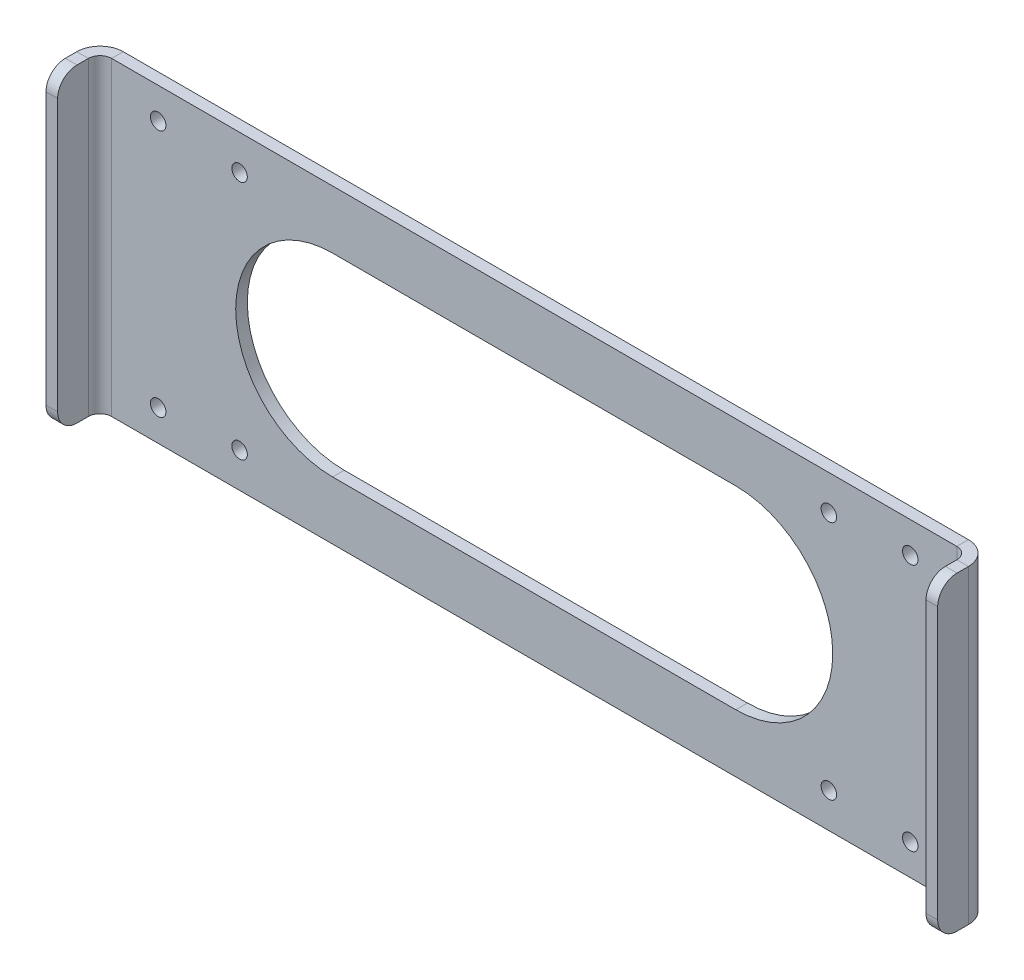
from build123d import *

# Parameters (mm, degrees)
SKETCH_1_W             = 248
SKETCH_1_H             = 80
SM_BASE_FLANGE_1_DEPTH = 3
SKETCH_6_R             = 2
CUT_EXTRUDE_1_DEPTH    = 10
OTHER_START            = -40
OTHER_1_DEPTH          = 80
OTHER_1_2_DEPTH        = 80
CUT_EXTRUDE_2_DEPTH    = 10
FILLET_1_R             = 5


# Read off the part's stored shape, not the designer's step: 绘制的折弯1
# Sheet-metal steps are written as plain solids
with BuildPart() as part:
    # Sketch 1 → 基体-法兰1 (new body)
    with BuildSketch(Plane.XY):
        Rectangle(SKETCH_1_W, SKETCH_1_H)
    extrude(amount=-SM_BASE_FLANGE_1_DEPTH)

    # 草图6 → 切除-拉伸1 (cut)
    with BuildSketch(Plane.XY):
        with Locations((-97, 32)):
            Circle(SKETCH_6_R)
        with Locations((-76, 31)):
            Circle(SKETCH_6_R)
        with Locations((97, 32)):
            Circle(SKETCH_6_R)
        with Locations((76, 31)):
            Circle(SKETCH_6_R)
        with Locations((76, -31)):
            Circle(SKETCH_6_R)
        with Locations((97, -32)):
            Circle(SKETCH_6_R)
        with Locations((-97, -32)):
            Circle(SKETCH_6_R)
        with Locations((-76, -31)):
            Circle(SKETCH_6_R)
    extrude(amount=-CUT_EXTRUDE_1_DEPTH, mode=Mode.SUBTRACT)

    # Other 1 outline → Other 1 (cut)
    with BuildSketch(Plane(origin=(0, 0, 0), x_dir=(1, 0, 0), z_dir=(0, 1, 0)).offset(OTHER_START)):
        with BuildLine():
            Line((124, 3), (109, 3))
            ThreePointArc((109, 3), (112, 2.196152423), (114.196152423, 0))
            Line((114.196152423, 0), (124, 0))
            Line((124, 0), (124, 3))
        make_face()
        with BuildLine():
            ThreePointArc((-114.196152423, 0), (-112, 2.196152423), (-109, 3))
            Line((-109, 3), (-124, 3))
            Line((-124, 3), (-124, 0))
            Line((-124, 0), (-114.196152423, 0))
        make_face()
    extrude(amount=OTHER_1_DEPTH, mode=Mode.SUBTRACT)

    # Other 1 2 outline → Other 1 2 (add)
    with BuildSketch(Plane(origin=(0, 0, 0), x_dir=(1, 0, 0), z_dir=(0, 1, 0)).offset(OTHER_START)):
        with BuildLine():
            ThreePointArc((115, -3), (114.795554958, -1.447085729), (114.196152423, 0))
            Line((114.196152423, 0), (109, 0))
            ThreePointArc((109, 0), (111.121320344, -0.878679656), (112, -3))
            Line((112, -3), (112, -10.931416529))
            Line((112, -10.931416529), (115, -10.931416529))
            Line((115, -10.931416529), (115, -3))
        make_face()
        with BuildLine():
            Line((-109, 0), (-114.196152423, 0))
            ThreePointArc((-114.196152423, 0), (-114.795554958, -1.447085729), (-115, -3))
            Line((-115, -3), (-115, -10.931416529))
            Line((-115, -10.931416529), (-112, -10.931416529))
            Line((-112, -10.931416529), (-112, -3))
            ThreePointArc((-112, -3), (-111.121320344, -0.878679656), (-109, 0))
        make_face()
    extrude(amount=OTHER_1_2_DEPTH)

    # 草图8 → 切除-拉伸2 (cut)
    with BuildSketch(Plane(origin=(0, 0, -3), x_dir=(-1, 0, 0), z_dir=(0, 0, -1))):
        with BuildLine():
            Line((-52, 25), (52, 25))
            ThreePointArc((52, 25), (77, 0), (52, -25))
            Line((52, -25), (-52, -25))
            ThreePointArc((-52, -25), (-77, 0), (-52, 25))
        make_face()
    extrude(amount=-CUT_EXTRUDE_2_DEPTH, mode=Mode.SUBTRACT)

    # 圆角1
    fillet_1_edges = [part.edges().sort_by_distance(p)[0] for p in [
        (113.5, 40, 10.931416529),
        (113.5, -40, 10.931416529),
        (-113.5, -40, 10.931416529),
        (-113.5, 40, 10.931416529),
    ]]
    fillet(fillet_1_edges, radius=FILLET_1_R)


solid = part.part
